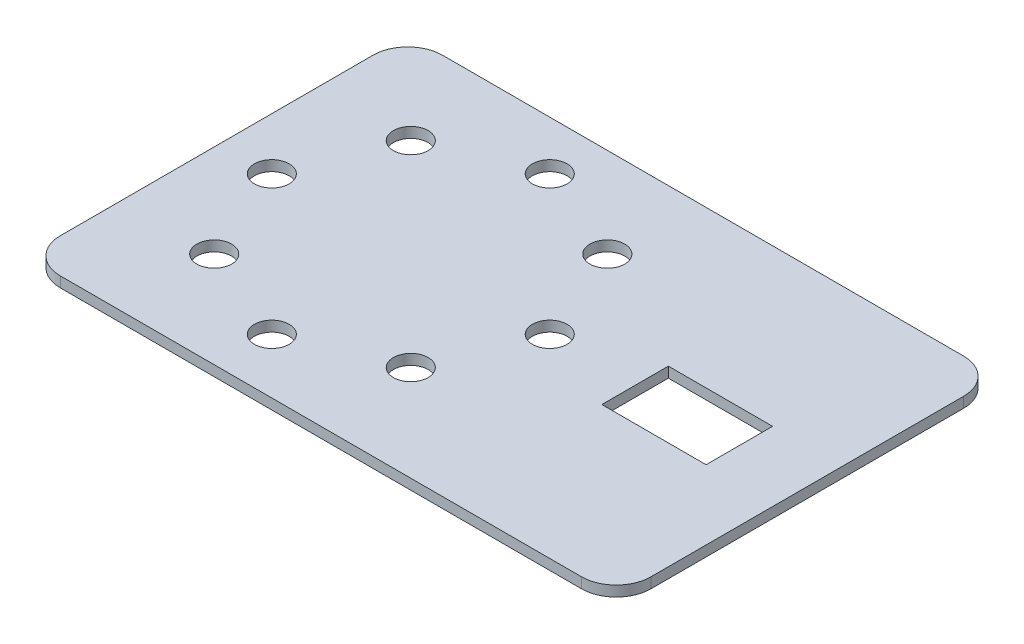
from build123d import *

# Parameters (mm, degrees)
SKETCH1_W           = 85
SKETCH1_H           = 55
SKETCH1_R           = 2.5
SKETCH1_W_2         = 15
SKETCH1_H_2         = 9.566733068
BOSS_EXTRUDE3_DEPTH = 1.5
FILLET2_R           = 5


with BuildPart() as part:
    # Sketch1 → Boss-Extrude3 (new body)
    with BuildSketch(Plane(origin=(0, 0, 0), x_dir=(1, 0, 0), z_dir=(0, 1, 0))):
        with Locations((0, -0.433266932)):
            Rectangle(SKETCH1_W, SKETCH1_H)
        with Locations((-35, 0)):
            Circle(SKETCH1_R, mode=Mode.SUBTRACT)
        with Locations((-29.142135624, 14.142135624)):
            Circle(SKETCH1_R, mode=Mode.SUBTRACT)
        with Locations((-15, 20)):
            Circle(SKETCH1_R, mode=Mode.SUBTRACT)
        with Locations((-0.857864376, 14.142135624)):
            Circle(SKETCH1_R, mode=Mode.SUBTRACT)
        with Locations((5, 0)):
            Circle(SKETCH1_R, mode=Mode.SUBTRACT)
        with Locations((-0.857864376, -14.142135624)):
            Circle(SKETCH1_R, mode=Mode.SUBTRACT)
        with Locations((-15, -20)):
            Circle(SKETCH1_R, mode=Mode.SUBTRACT)
        with Locations((-29.142135624, -14.142135624)):
            Circle(SKETCH1_R, mode=Mode.SUBTRACT)
        with Locations((25, -0.216633466)):
            Rectangle(SKETCH1_W_2, SKETCH1_H_2, mode=Mode.SUBTRACT)
    extrude(amount=BOSS_EXTRUDE3_DEPTH)

    # Fillet2
    fillet2_edges = [part.edges().sort_by_distance(p)[0] for p in [
        (42.5, 0.75, -27.066733068),
        (-42.5, 0.75, -27.066733068),
        (-42.5, 0.75, 27.933266932),
        (42.5, 0.75, 27.933266932),
    ]]
    fillet(fillet2_edges, radius=FILLET2_R)


solid = part.part
